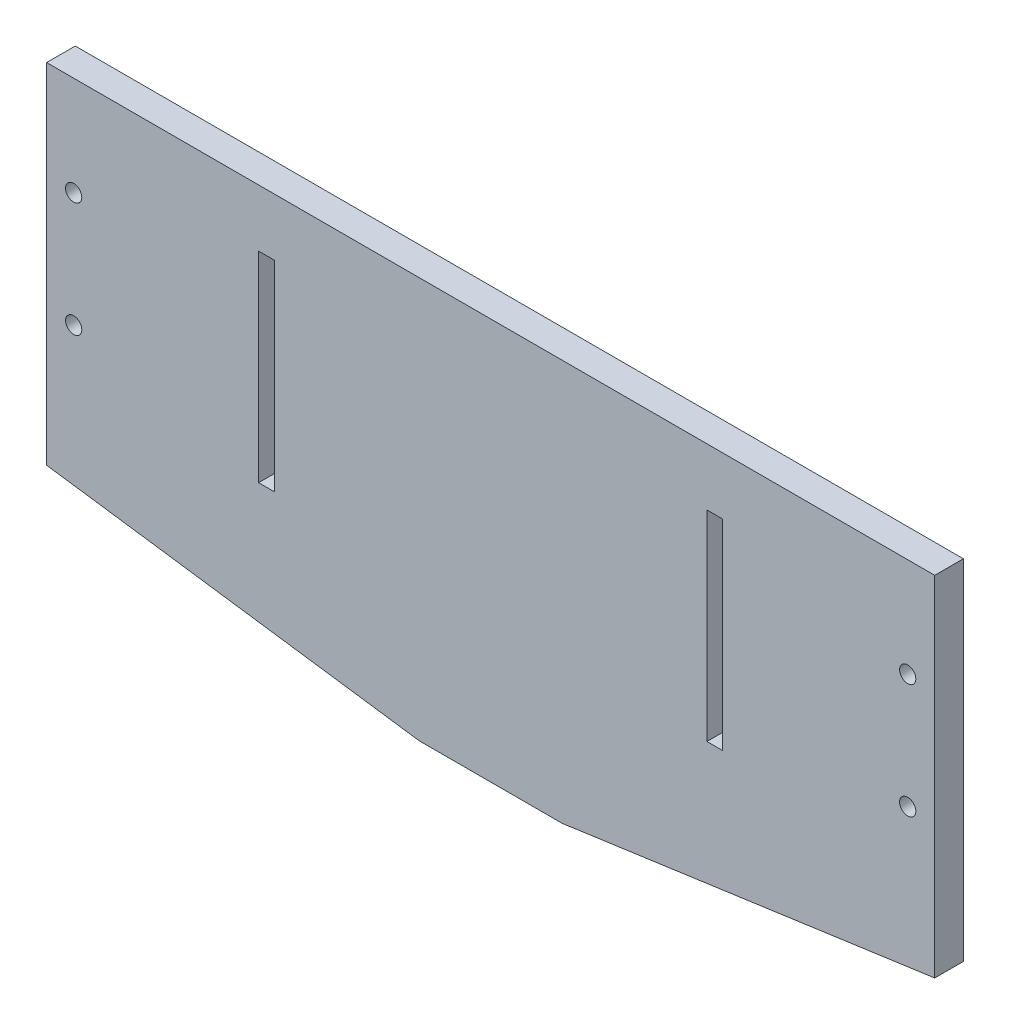
from build123d import *

# Parameters (mm, degrees)
SKETCH1_W            = 196.85
SKETCH1_H            = 127
BOSS_EXTRUDE1_DEPTH  = 6.35
M3_CLEARANCE_HOLE1_D = 3.6
SKETCH4_W            = 3.5052
SKETCH4_H            = 44.45
CUT_EXTRUDE1_DEPTH   = 235.348554508
CUT_EXTRUDE2_DEPTH   = 235.348554508


with BuildPart() as part:
    # Sketch1 → Boss-Extrude1 (new body)
    with BuildSketch(Plane.XY):
        with Locations((98.425, 63.5)):
            Rectangle(SKETCH1_W, SKETCH1_H)
    extrude(amount=BOSS_EXTRUDE1_DEPTH)

    # M3 Clearance Hole1 (through all)
    with Locations(Plane.XY.offset(6.35)):
        with Locations((5.9944, 105.0036), (5.9944, 79.6036), (190.8556, 79.6036), (190.8556, 105.0036)):
            Hole(M3_CLEARANCE_HOLE1_D / 2)

    # Sketch4 → Cut-Extrude1 (cut, through all)
    with BuildSketch(Plane.XY.offset(6.35)):
        with Locations((48.7426, 92.075)):
            Rectangle(SKETCH4_W, SKETCH4_H)
        with Locations((148.1074, 92.075)):
            Rectangle(SKETCH4_W, SKETCH4_H)
    extrude(amount=-CUT_EXTRUDE1_DEPTH, mode=Mode.SUBTRACT)

    # Sketch5 → Cut-Extrude2 (cut, through all)
    with BuildSketch(Plane.XY.offset(6.35)):
        Polygon((0, 49.701645905), (82.55, 38.1), (114.3, 38.1), (196.85, 49.701645905), (196.85, 0), (0, 0), align=None)
    extrude(amount=-CUT_EXTRUDE2_DEPTH, mode=Mode.SUBTRACT)


solid = part.part
